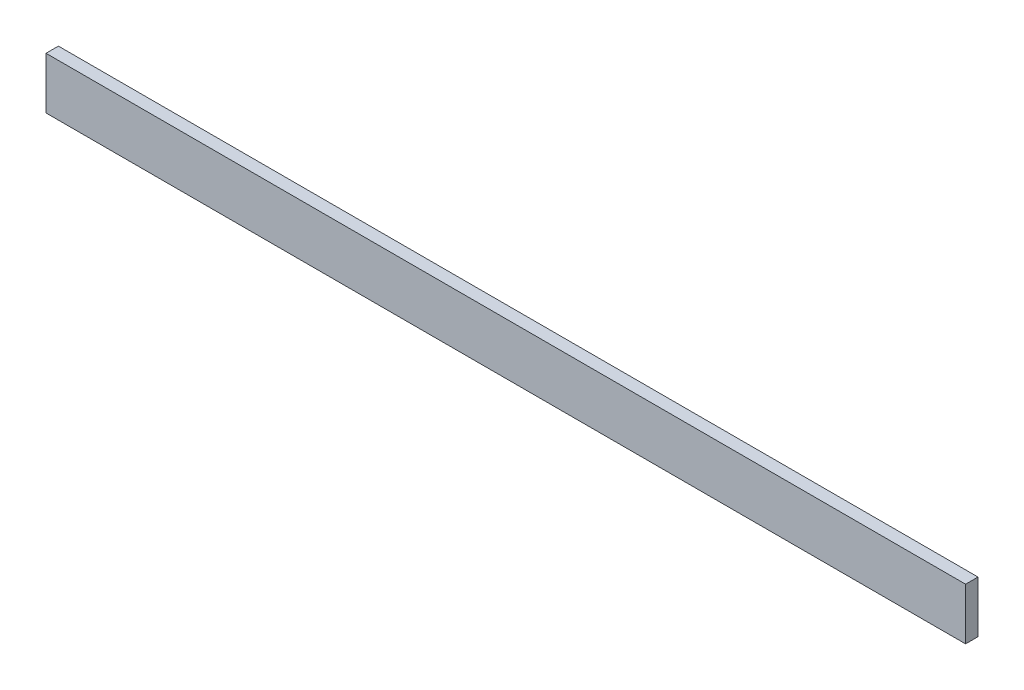
from build123d import *

# Parameters (mm, degrees)
SKETCH1_W           = 177.8
SKETCH1_H           = 10
BOSS_EXTRUDE1_DEPTH = 2.4


with BuildPart() as part:
    # Sketch1 → Boss-Extrude1 (new body)
    with BuildSketch(Plane.XY):
        Rectangle(SKETCH1_W, SKETCH1_H)
    extrude(amount=BOSS_EXTRUDE1_DEPTH)


solid = part.part
